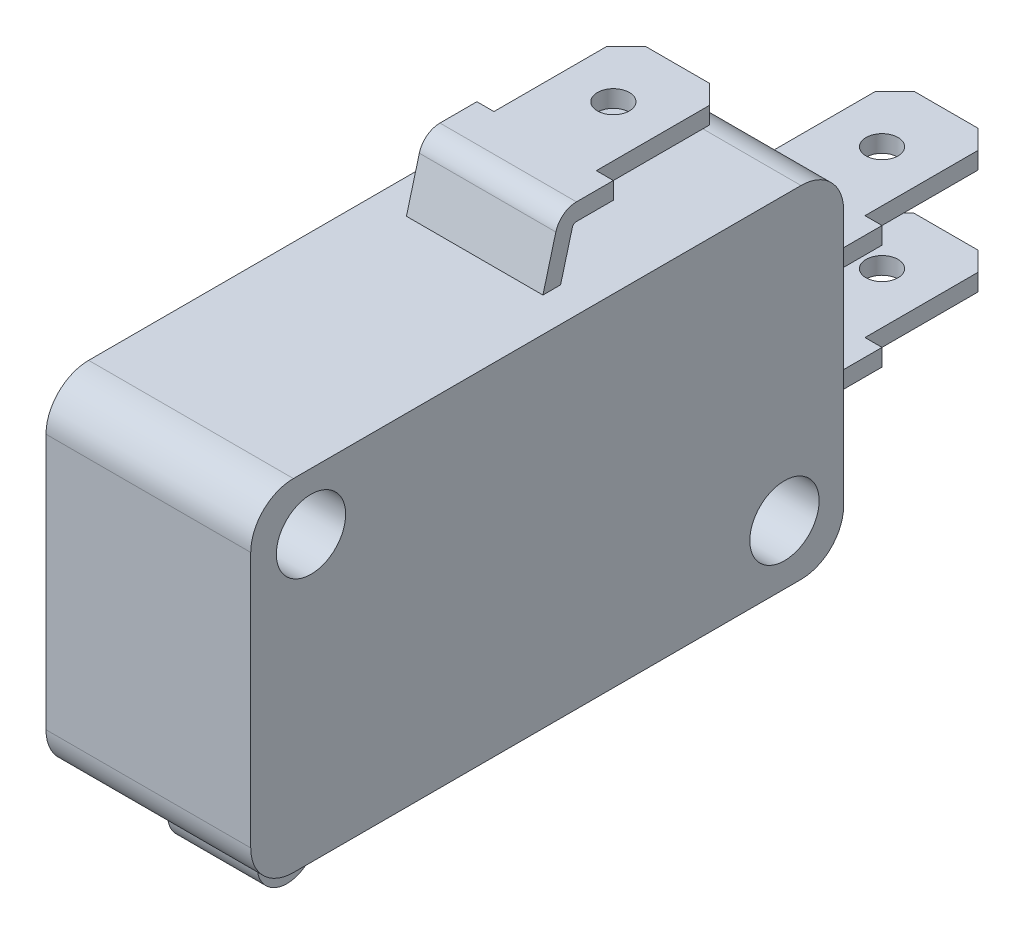
from build123d import *

# Parameters (mm, degrees)
CROQUIS1_W              = 27.8
CROQUIS1_H              = 16
SALIENTE_EXTRUIR1_DEPTH = 4.8
REDONDEO1_R             = 2
SALIENTE_EXTRUIR2_START = 2.075
CROQUIS2_R              = 0.75
SALIENTE_EXTRUIR2_DEPTH = 0.8
SALIENTE_EXTRUIR3_DEPTH = 3.2
CROQUIS4_R              = 0.75
SALIENTE_EXTRUIR4_DEPTH = 0.8
CROQUIS5_R              = 1.625
CORTAR_EXTRUIR1_DEPTH   = 28.66604417
CROQUIS6_W              = 4.2
CROQUIS6_H              = 2.8
SALIENTE_EXTRUIR5_DEPTH = 3
REDONDEO2_R             = 1.4


with BuildPart() as part:
    # Croquis1 → Saliente-Extruir1 (new, symmetric)
    with BuildSketch(Plane(origin=(0, 0, 0), x_dir=(0, 0, -1), z_dir=(1, 0, 0))):
        Rectangle(CROQUIS1_W, CROQUIS1_H)
    extrude(amount=SALIENTE_EXTRUIR1_DEPTH, both=True)

    # Redondeo1
    redondeo1_edges = [part.edges().sort_by_distance(p)[0] for p in [
        (0, -8, -13.9),
        (0, -8, 13.9),
        (0, 8, 13.9),
        (0, 8, -13.9),
    ]]
    fillet(redondeo1_edges, radius=REDONDEO1_R)

    # Croquis2 → Saliente-Extruir2 (add)
    with BuildSketch(Plane(origin=(0, 0, 0), x_dir=(1, 0, 0), z_dir=(0, 1, 0)).offset(SALIENTE_EXTRUIR2_START)):
        Polygon((3.2, 13.9), (-3.2, 13.9), (-3.2, 17.3), (-2.4, 17.3), (-2.4, 22.6), (-1.5, 23.5), (1.5, 23.5), (2.4, 22.6), (2.4, 17.3), (3.2, 17.3), align=None)
        with Locations(Location((0, 20.5, 0), (0, 0, 270))):
            Circle(CROQUIS2_R, mode=Mode.SUBTRACT)
    saliente_extruir2 = extrude(amount=SALIENTE_EXTRUIR2_DEPTH)

    # Simetría1: Saliente-Extruir2 across plane
    add(saliente_extruir2.mirror(Plane.ZX))

    # Croquis3 → Saliente-Extruir3 (add, symmetric)
    with BuildSketch(Plane(origin=(0, 0, 0), x_dir=(0, 0, -1), z_dir=(1, 0, 0))):
        with BuildLine():
            Line((1.4, 8), (2.005248739, 10.258819045))
            ThreePointArc((2.005248739, 10.258819045), (2.362413136, 10.79335334), (2.971174565, 11))
            Line((2.971174565, 11), (4.703847577, 11))
            Line((4.703847577, 11), (4.703847577, 10.2))
            Line((4.703847577, 10.2), (2.971174565, 10.2))
            ThreePointArc((2.971174565, 10.2), (2.849422279, 10.158670668), (2.7779894, 10.051763809))
            Line((2.7779894, 10.051763809), (2.228220944, 8))
            Line((2.228220944, 8), (1.4, 8))
        make_face()
    extrude(amount=SALIENTE_EXTRUIR3_DEPTH, both=True)

    # Croquis4 → Saliente-Extruir4 (add)
    with BuildSketch(Plane(origin=(0, 11, 0), x_dir=(1, 0, 0), z_dir=(0, 1, 0))):
        Polygon((-2.4, 4.703847577), (-2.4, 10.003847577), (-1.5, 10.903847577), (1.5, 10.903847577), (2.4, 10.003847577), (2.4, 4.703847577), align=None)
        with Locations(Location((0, 7.903847577, 0), (0, 0, 270))):
            Circle(CROQUIS4_R, mode=Mode.SUBTRACT)
    extrude(amount=-SALIENTE_EXTRUIR4_DEPTH)

    # Croquis5 → Cortar-Extruir1 (cut, through all)
    with BuildSketch(Plane(origin=(4.8, 0, 0), x_dir=(0, 0, -1), z_dir=(1, 0, 0))):
        with Locations((-11.075, 5.325)):
            Circle(CROQUIS5_R)
        with Locations((11.125, -5.225)):
            Circle(CROQUIS5_R)
    extrude(amount=-CORTAR_EXTRUIR1_DEPTH, mode=Mode.SUBTRACT)

    # Croquis6 → Saliente-Extruir5 (add)
    with BuildSketch(Plane.XZ.offset(8)):
        with Locations((0, 9.5)):
            Rectangle(CROQUIS6_W, CROQUIS6_H)
    extrude(amount=SALIENTE_EXTRUIR5_DEPTH)

    # Redondeo2
    redondeo2_edges = [part.edges().sort_by_distance(p)[0] for p in [
        (0, -11, 8.1),
        (0, -11, 10.9),
    ]]
    fillet(redondeo2_edges, radius=REDONDEO2_R - 0.0001)  # a hair under: the kernel refuses the full size


solid = part.part
